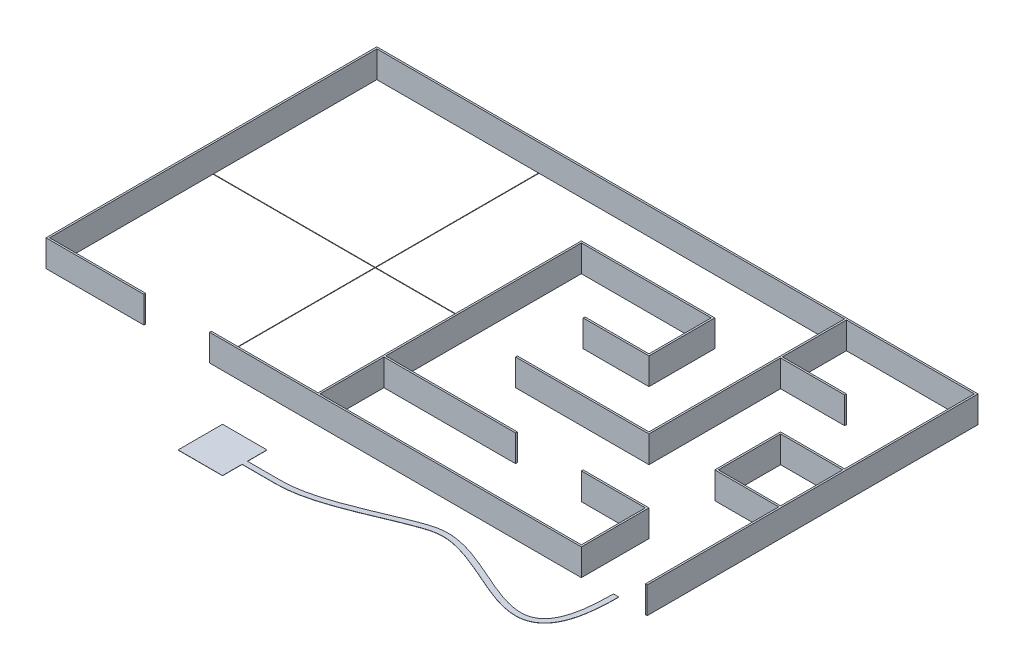
from build123d import *

# Parameters (mm, degrees)
BOSS_EXTRUDE3_DEPTH   = 150
SKETCH2_W             = 350
SKETCH2_H             = 350
BOSS_EXTRUDE3_2_DEPTH = 150
BOSS_EXTRUDE4_DEPTH   = 1
SKETCH4_W             = 600
SKETCH4_H             = 10
BOSS_EXTRUDE5_DEPTH   = 150
BOSS_EXTRUDE6_DEPTH   = 1


with BuildPart() as part:
    # Sketch2 → Boss-Extrude3 (new body)
    with BuildSketch(Plane(origin=(0, 0, 0), x_dir=(1, 0, 0), z_dir=(0, 1, 0))):
        Polygon((150, 757.491220574), (150, 397.491220574), (1620, 397.491220574), (1620, 757.491220574), (1260, 757.491220574), (1260, 767.491220574), (1630, 767.491220574), (1630, 387.491220574), (140, 387.491220574), (140, 1877.491220574), (890, 1877.491220574), (890, 1507.491220574), (520, 1507.491220574), (520, 1517.491220574), (880, 1517.491220574), (880, 1867.491220574), (150, 1867.491220574), (150, 767.491220574), (890, 767.491220574), (890, 757.491220574), align=None)
    extrude(amount=BOSS_EXTRUDE3_DEPTH)



with BuildPart() as body_2:
    # Sketch2 → Boss-Extrude3 2 (new body)
    with BuildSketch(Plane(origin=(0, 0, 0), x_dir=(1, 0, 0), z_dir=(0, 1, 0))):
        Polygon((2000, 387.491220574), (2000, 2247.491220574), (140, 2247.491220574), (140, 2237.491220574), (1260, 2237.491220574), (1260, 1137.491220574), (520, 1137.491220574), (520, 1127.491220574), (1270, 1127.491220574), (1270, 1867.491220574), (1630, 1867.491220574), (1630, 1877.491220574), (1270, 1877.491220574), (1270, 2237.491220574), (1990, 2237.491220574), (1990, 1507.491220574), (1630, 1507.491220574), (1630, 1137.491220574), (1990, 1137.491220574), (1990, 387.491220574), align=None)
        with Locations((1815, 1322.491220574)):
            Rectangle(SKETCH2_W, SKETCH2_H, mode=Mode.SUBTRACT)
    extrude(amount=BOSS_EXTRUDE3_2_DEPTH)


with BuildPart() as body_3:
    # Sketch3 → Boss-Extrude4 (new body)
    with BuildSketch(Plane(origin=(0, 0, 0), x_dir=(1, 0, 0), z_dir=(0, 1, 0))):
        with BuildLine():
            Line((-125, -125), (125, -125))
            Line((125, -125), (125, -15))
            Line((125, -15), (315.840830448, -15))
            add(Edge.make_bspline(
                [(315.840830448, -15), (320.389169141, -15), (329.472565329, -14.876307848), (347.735751206, -14.151598317), (370.662997723, -12.383302158), (398.322250448, -8.984588583), (435.346483827, -2.885904596), (481.825446358, 7.424859346), (537.672507135, 23.311663436), (593.344719177, 41.941936098), (648.587598152, 62.554238115), (703.138807556, 84.392456125), (756.728041942, 106.703091226), (809.075149355, 128.73407702), (851.424234972, 146.233201155), (884.382329075, 159.342358297), (908.615591276, 168.632435119), (932.262745744, 177.300159418), (955.297668384, 184.973565985), (978.024783126, 191.321858362), (1000.689862867, 196.030623321), (1019.770010481, 198.345031628), (1035.321190901, 199.072430039), (1051.220452264, 199.050442109), (1071.674960731, 197.67684921), (1105.539711238, 192.824205006), (1149.740719452, 182.225910655), (1204.95607283, 163.814819064), (1261.571253915, 141.370600051), (1318.869989753, 116.587074085), (1376.182408071, 91.170583965), (1432.881329204, 66.830460267), (1488.387016416, 45.280164022), (1542.183075525, 28.250370144), (1593.84124928, 17.530820516), (1643.014546996, 15.076095837), (1689.243673041, 23.195423079), (1731.195657875, 44.40170986), (1760.733560789, 74.08543551), (1780.554909925, 105.21946027), (1793.517745652, 132.381152981), (1804.568870062, 163.518834481), (1813.702117839, 198.83994932), (1819.69484107, 231.950196291), (1823.498185411, 260.762005298), (1825.848927655, 283.562308809), (1827.691124181, 307.583779473), (1828.796324957, 328.643478089), (1829.418570121, 346.131873103), (1829.753269616, 359.569842324), (1829.92133119, 371.047009548), (1829.988735778, 380.380369447), (1830, 385.127646607), (1830, 387.491220574)],
                knots=[0, 0, 0, 0, 0.0078125, 0.015625, 0.03125, 0.046875, 0.0625, 0.09375, 0.125, 0.15625, 0.1875, 0.21875, 0.25, 0.28125, 0.3125, 0.328125, 0.34375, 0.359375, 0.375, 0.390625, 0.40625, 0.421875, 0.4296875, 0.4375, 0.453125, 0.46875, 0.5, 0.53125, 0.5625, 0.59375, 0.625, 0.65625, 0.6875, 0.71875, 0.75, 0.78125, 0.8125, 0.84375, 0.875, 0.890625, 0.90625, 0.921875, 0.9375, 0.953125, 0.9609375, 0.96875, 0.9765625, 0.984375, 0.98828125, 0.9921875, 0.99609375, 0.998046875, 1, 1, 1, 1], degree=3))
            Line((1830, 387.491220574), (1830, 397.757164169))
            Line((1830, 397.757164169), (1800, 397.757164169))
            Line((1800, 397.757164169), (1800, 387.491220574))
            add(Edge.make_bspline(
                [(315.840830448, 15), (320.122545017, 15), (328.66419316, 15.116272077), (345.912449927, 15.800195947), (367.652531943, 17.475603355), (394.029010996, 20.715081137), (429.518354718, 26.559099246), (474.390779456, 36.506521587), (528.74067533, 51.96193911), (583.284817286, 70.210995183), (637.720773593, 90.51982039), (691.754171695, 112.149285361), (745.098801445, 134.357400342), (797.477318333, 156.401660874), (840.09791441, 174.013992102), (873.450709681, 187.280642893), (898.062610541, 196.71598246), (922.245968323, 205.58264388), (946.419277971, 213.642189267), (970.829677575, 220.46957998), (995.744871057, 225.656549919), (1017.113887382, 228.2566064), (1034.673449168, 229.077298145), (1052.406307251, 229.049871189), (1074.901342418, 227.531358744), (1111.490864908, 222.276594942), (1158.208571322, 211.042086428), (1215.382188629, 191.960082359), (1273.166209593, 169.04378325), (1331.00099985, 144.025044739), (1388.280424053, 118.623361328), (1444.355681004, 94.555228618), (1498.530519839, 73.532895068), (1550.045347341, 57.251873113), (1598.052439301, 47.346813475), (1641.622780975, 45.294229176), (1673.553590583, 51.041519234), (1696.499912333, 60.60727454), (1712.532876549, 70.482176741), (1727.486724592, 83.365151977), (1741.389930752, 99.631969506), (1754.171644441, 119.653089434), (1765.695895782, 143.747032334), (1775.805065897, 172.175079405), (1784.347605964, 205.158586551), (1790.047634355, 236.607984721), (1793.696568948, 264.241528371), (1795.964125997, 286.227518229), (1797.749384637, 309.498409629), (1798.824744629, 329.981194712), (1799.431588433, 347.034686352), (1799.75853366, 360.159117428), (1799.922955889, 371.385311204), (1799.988960182, 380.523216734), (1800, 385.175489397), (1800, 387.491220574)],
                knots=[0, 0, 0, 0, 0.0078125, 0.015625, 0.03125, 0.046875, 0.0625, 0.09375, 0.125, 0.15625, 0.1875, 0.21875, 0.25, 0.28125, 0.3125, 0.328125, 0.34375, 0.359375, 0.375, 0.390625, 0.40625, 0.421875, 0.4296875, 0.4375, 0.453125, 0.46875, 0.5, 0.53125, 0.5625, 0.59375, 0.625, 0.65625, 0.6875, 0.71875, 0.75, 0.78125, 0.8125, 0.828125, 0.84375, 0.859375, 0.875, 0.890625, 0.90625, 0.921875, 0.9375, 0.953125, 0.9609375, 0.96875, 0.9765625, 0.984375, 0.98828125, 0.9921875, 0.99609375, 0.998046875, 1, 1, 1, 1], degree=3))
            Line((315.840830448, 15), (125, 15))
            Line((125, 15), (125, 125))
            Line((125, 125), (-125, 125))
            Line((-125, 125), (-125, -125))
        make_face()
    extrude(amount=BOSS_EXTRUDE4_DEPTH)


with BuildPart() as part_1:
    add(part.part)

    add(body_2.part)  # Boss-Extrude5 merges body 2
    # Sketch4 → Boss-Extrude5 (add)
    with BuildSketch(Plane(origin=(0, 0, 0), x_dir=(1, 0, 0), z_dir=(0, 1, 0))):
        Polygon((140, 2237.491220574), (140, 2247.491220574), (-1380, 2247.491220574), (-1380, 387.491220574), (-830, 387.491220574), (-830, 397.491220574), (-1370, 397.491220574), (-1370, 2237.491220574), align=None)
        with Locations((-160, 392.491220574)):
            Rectangle(SKETCH4_W, SKETCH4_H)
    extrude(amount=BOSS_EXTRUDE5_DEPTH)

    # Sketch5 → Boss-Extrude6 (add)
    with BuildSketch(Plane(origin=(0, 0, 0), x_dir=(1, 0, 0), z_dir=(0, 1, 0))):
        Polygon((-1370, 1318.491220574), (-1370, 1316.491220574), (-460, 1316.491220574), (-460, 397.491220574), (-458, 397.491220574), (-458, 1316.491220574), (140, 1316.491220574), (140, 1318.491220574), (-458, 1318.491220574), (-458, 2237.491220574), (-460, 2237.491220574), (-460, 1318.491220574), align=None)
    extrude(amount=BOSS_EXTRUDE6_DEPTH)


solid = Compound([body_3.part, part_1.part])
